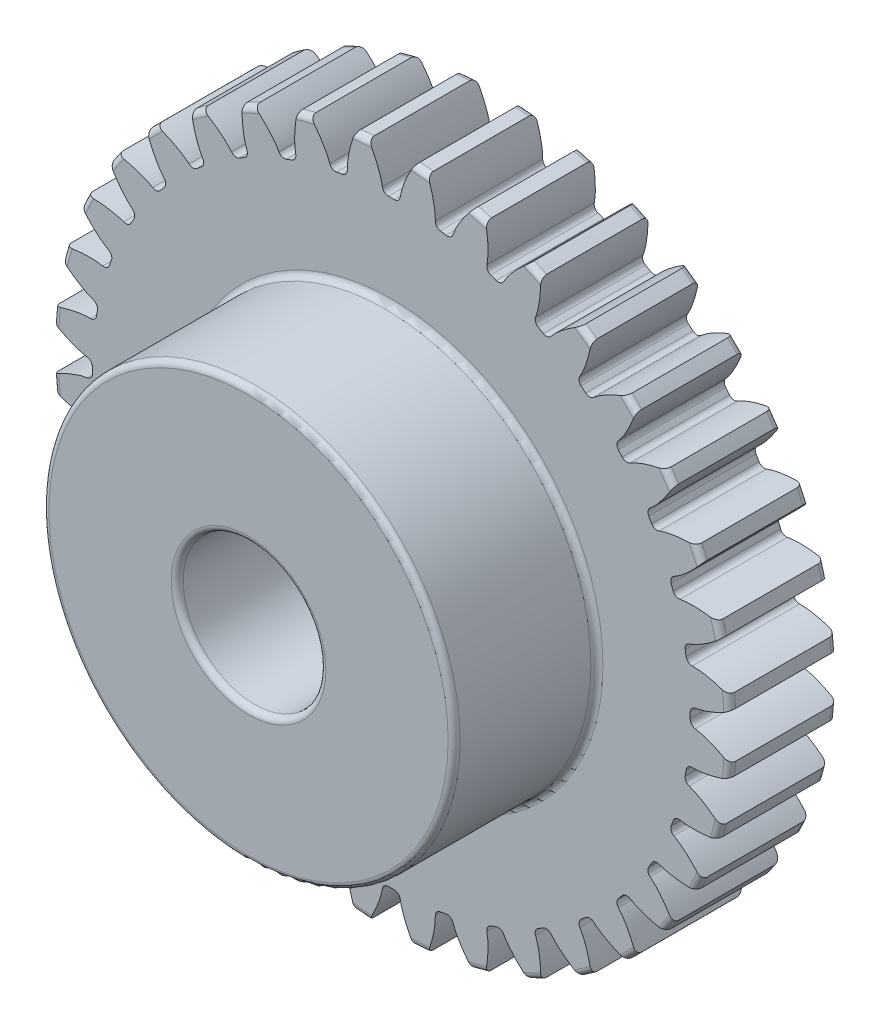
from build123d import *

# Parameters (mm, degrees)
BOSS_EXTRUDE1_DEPTH      = 5.5626
BOSS_EXTRUDE1_DEPTH_BACK = 5.5626
SKETCH3_R                = 15.08125
SKETCH5_W                = 6.35
SKETCH5_H                = 5.93725
SKETCH5_W_2              = 11.1252
SKETCH5_H_2              = 3.175
FILLET2_R                = 0.266307122
CUT_EXTRUDE1_DEPTH       = 23.041568139
FILLET1_R                = 0.266307122
CIRPATTERN1_COUNT        = 36
FILLET1_OF_CIRPATTERN1_R = 0.266307122


with BuildPart() as part:
    # Sketch3 → Boss-Extrude1 (new, two sides: drawn at the far end of the back side and taken through both)
    with BuildSketch(Plane.XY.offset(-BOSS_EXTRUDE1_DEPTH_BACK)):
        Circle(SKETCH3_R)
    extrude(amount=BOSS_EXTRUDE1_DEPTH + BOSS_EXTRUDE1_DEPTH_BACK)

    # Sketch5 → Cut-Revolve1 (revolve, cut)
    with BuildSketch(Plane(origin=(0, 0, 0), x_dir=(0, 0, -1), z_dir=(1, 0, 0)), mode=Mode.PRIVATE) as cut_revolve1_sk:
        with Locations((-2.3876, 12.112625)):
            Rectangle(SKETCH5_W, SKETCH5_H)
        with Locations((0, 1.5875)):
            Rectangle(SKETCH5_W_2, SKETCH5_H_2)
    revolve(cut_revolve1_sk.sketch.rotate(Axis((0, 0, 5.5626), (0, 0, -1)), 90), axis=Axis((0, 0, 5.5626), (0, 0, -1)), mode=Mode.SUBTRACT)

    # Fillet2
    fillet2_edges = [part.edges().sort_by_distance(p)[0] for p in [
        (-3.175, 0, 5.5626),
        (-3.175, 0, -5.5626),
        (-9.144, 0, 5.5626),
        (-9.144, 0, -0.7874),
        (-15.08125, 0, -0.7874),
        (-15.08125, 0, -5.5626),
    ]]
    fillet(fillet2_edges, radius=FILLET2_R)

    # Sketch4 → Cut-Extrude1 (cut, symmetric)
    with BuildSketch(Plane.XY):
        with BuildLine():
            Line((13.289826256, 0.381906465), (13.420318207, 0.38565638))
            add(Edge.make_bspline(
                [(13.420318207, 0.38565638), (13.422914897, 0.38575914), (13.430195068, 0.386134439), (13.443946597, 0.387187852), (13.466365456, 0.389395164), (13.494898024, 0.392925562), (13.531733888, 0.398312963), (13.575066094, 0.405719519), (13.622616226, 0.414969571), (13.67426481, 0.426231474), (13.725711415, 0.438526192), (13.776951293, 0.451776589), (13.827917483, 0.465864991), (13.889556653, 0.48398078), (13.963328411, 0.507162879), (14.049336344, 0.53638473), (14.14660985, 0.572034133), (14.245435829, 0.611046633), (14.342416431, 0.65163616), (14.44007817, 0.695175469), (14.534340064, 0.739093632), (14.63189425, 0.787299214), (14.721762066, 0.833111555), (14.822031607, 0.88729925), (14.90283031, 0.931864642), (14.985934696, 0.980284581), (15.026328374, 1.004202572), (15.046949136, 1.016574283)],
                knots=[0, 0, 0, 0, 0, 0.005376749, 0.015083688, 0.02853182, 0.04661014, 0.064854849, 0.092110526, 0.119476176, 0.146842496, 0.174208854, 0.201574956, 0.228941013, 0.256307345, 0.307035032, 0.361767352, 0.416499661, 0.471231937, 0.525964282, 0.580696616, 0.635428982, 0.690161387, 0.744893688, 0.799626082, 0.854358407, 0.909090914, 0.909090914, 0.909090914, 0.909090914, 0.909090914], degree=4))
            ThreePointArc((15.046949136, 1.016574283), (15.08125, 0), (15.046949136, -1.016574283))
            add(Edge.make_bspline(
                [(13.420318207, -0.38565638), (13.422914897, -0.38575914), (13.430195068, -0.386134439), (13.443946597, -0.387187852), (13.466365456, -0.389395164), (13.494898024, -0.392925562), (13.531733888, -0.398312963), (13.575066094, -0.405719519), (13.622616226, -0.414969571), (13.67426481, -0.426231474), (13.725711415, -0.438526192), (13.776951293, -0.451776589), (13.827917483, -0.465864991), (13.889556653, -0.48398078), (13.963328411, -0.507162879), (14.049336344, -0.53638473), (14.14660985, -0.572034133), (14.245435829, -0.611046633), (14.342416431, -0.65163616), (14.44007817, -0.695175469), (14.534340064, -0.739093632), (14.63189425, -0.787299214), (14.721762066, -0.833111555), (14.822031607, -0.88729925), (14.90283031, -0.931864642), (14.985934696, -0.980284581), (15.026328374, -1.004202572), (15.046949136, -1.016574283)],
                knots=[0, 0, 0, 0, 0, 0.005376749, 0.015083688, 0.02853182, 0.04661014, 0.064854849, 0.092110526, 0.119476176, 0.146842496, 0.174208854, 0.201574956, 0.228941013, 0.256307345, 0.307035032, 0.361767352, 0.416499661, 0.471231937, 0.525964282, 0.580696616, 0.635428982, 0.690161387, 0.744893688, 0.799626082, 0.854358407, 0.909090914, 0.909090914, 0.909090914, 0.909090914, 0.909090914], degree=4))
            Line((13.420318207, -0.38565638), (13.289826256, -0.381906465))
            ThreePointArc((13.289826256, -0.381906465), (13.2953125, 0), (13.289826256, 0.381906465))
        make_face()
    cut_extrude1 = extrude(amount=CUT_EXTRUDE1_DEPTH, both=True, mode=Mode.SUBTRACT)

    # Fillet1
    fillet1_edges = [part.edges().sort_by_distance(p)[0] for p in [
        (13.289826256, -0.381906465, -3.175),
        (13.289826256, 0.381906465, -3.175),
    ]]
    fillet(fillet1_edges, radius=FILLET1_R)

    # CirPattern1: Cut-Extrude1 ×36 about axis
    cirpattern1_axis = Axis((0, 0, 5.5626), (0, 0, -1))
    for i in range(1, CIRPATTERN1_COUNT):
        add(cut_extrude1.rotate(cirpattern1_axis, i * 360 / CIRPATTERN1_COUNT), mode=Mode.SUBTRACT)

    # Fillet1 of CirPattern1
    fillet1_of_cirpattern1_edges = [part.edges().sort_by_distance(p)[0] for p in [
        (13.021606572, -2.683858559, -3.175),
        (13.154241295, -1.931649663, -3.175),
        (12.357731961, -4.904262968, -3.175),
        (12.618971369, -4.186513594, -3.175),
        (11.318373917, -6.975653829, -3.175),
        (11.700280382, -6.314172428, -3.175),
        (9.93511281, -8.835092978, -3.175),
        (10.426082298, -8.249978327, -3.175),
        (8.249978327, -10.426082298, -3.175),
        (8.835092978, -9.93511281, -3.175),
        (6.314172428, -11.700280382, -3.175),
        (6.975653829, -11.318373917, -3.175),
        (4.186513594, -12.618971369, -3.175),
        (4.904262968, -12.357731961, -3.175),
        (1.931649663, -13.154241295, -3.175),
        (2.683858559, -13.021606572, -3.175),
        (-0.381906465, -13.289826256, -3.175),
        (0.381906465, -13.289826256, -3.175),
        (-2.683858559, -13.021606572, -3.175),
        (-1.931649663, -13.154241295, -3.175),
        (-4.904262968, -12.357731961, -3.175),
        (-4.186513594, -12.618971369, -3.175),
        (-6.975653829, -11.318373917, -3.175),
        (-6.314172428, -11.700280382, -3.175),
        (-8.835092978, -9.93511281, -3.175),
        (-8.249978327, -10.426082298, -3.175),
        (-10.426082298, -8.249978327, -3.175),
        (-9.93511281, -8.835092978, -3.175),
        (-11.700280382, -6.314172428, -3.175),
        (-11.318373917, -6.975653829, -3.175),
        (-12.618971369, -4.186513594, -3.175),
        (-12.357731961, -4.904262968, -3.175),
        (-13.154241295, -1.931649663, -3.175),
        (-13.021606572, -2.683858559, -3.175),
        (-13.289826256, 0.381906465, -3.175),
        (-13.289826256, -0.381906465, -3.175),
        (-13.021606572, 2.683858559, -3.175),
        (-13.154241295, 1.931649663, -3.175),
        (-12.357731961, 4.904262968, -3.175),
        (-12.618971369, 4.186513594, -3.175),
        (-11.318373917, 6.975653829, -3.175),
        (-11.700280382, 6.314172428, -3.175),
        (-9.93511281, 8.835092978, -3.175),
        (-10.426082298, 8.249978327, -3.175),
        (-8.249978327, 10.426082298, -3.175),
        (-8.835092978, 9.93511281, -3.175),
        (-6.314172428, 11.700280382, -3.175),
        (-6.975653829, 11.318373917, -3.175),
        (-4.186513594, 12.618971369, -3.175),
        (-4.904262968, 12.357731961, -3.175),
        (-1.931649663, 13.154241295, -3.175),
        (-2.683858559, 13.021606572, -3.175),
        (0.381906465, 13.289826256, -3.175),
        (-0.381906465, 13.289826256, -3.175),
        (2.683858559, 13.021606572, -3.175),
        (1.931649663, 13.154241295, -3.175),
        (4.904262968, 12.357731961, -3.175),
        (4.186513594, 12.618971369, -3.175),
        (6.975653829, 11.318373917, -3.175),
        (6.314172428, 11.700280382, -3.175),
        (8.835092978, 9.93511281, -3.175),
        (8.249978327, 10.426082298, -3.175),
        (10.426082298, 8.249978327, -3.175),
        (9.93511281, 8.835092978, -3.175),
        (11.700280382, 6.314172428, -3.175),
        (11.318373917, 6.975653829, -3.175),
        (12.618971369, 4.186513594, -3.175),
        (12.357731961, 4.904262968, -3.175),
        (13.154241295, 1.931649663, -3.175),
        (13.021606572, 2.683858559, -3.175),
    ]]
    fillet(fillet1_of_cirpattern1_edges, radius=FILLET1_OF_CIRPATTERN1_R)


solid = part.part
